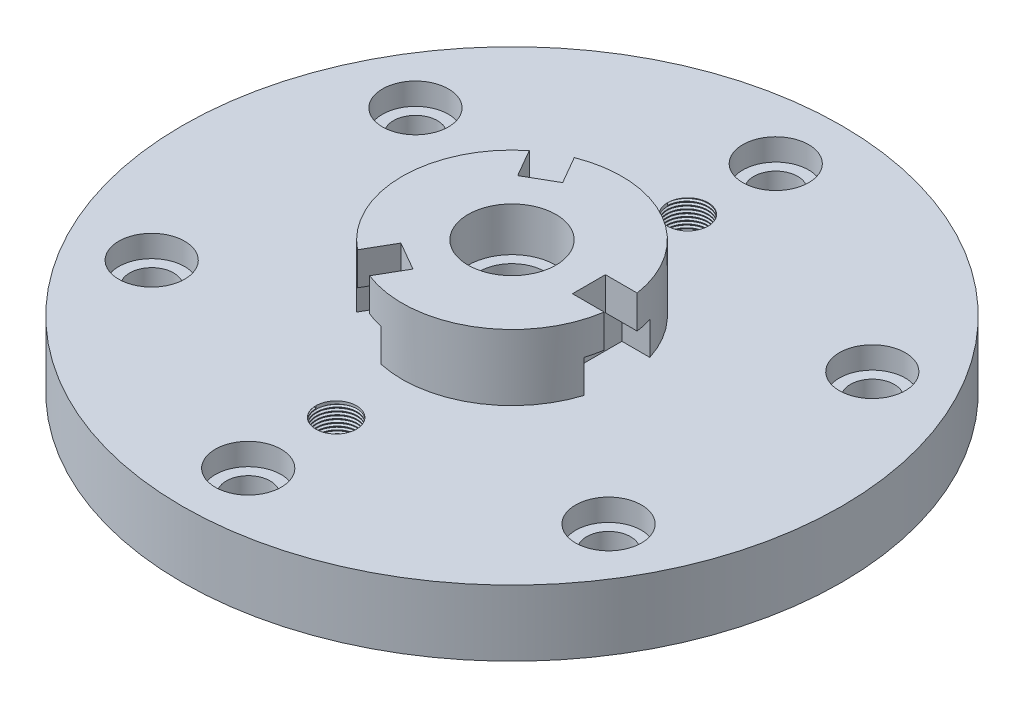
from build123d import *

# Parameters (mm, degrees)
CUT_EXTRUDE1_START                       = 35
CUT_EXTRUDE1_DEPTH                       = 200.520787991
CIRPATTERN1_COUNT                        = 3
CBORE_FOR_M20_HEX_HEAD_BOLT1_D           = 20
CBORE_FOR_M20_HEX_HEAD_BOLT1_CBORE_D     = 30
CBORE_FOR_M20_HEX_HEAD_BOLT1_CBORE_DEPTH = 10
CIRPATTERN2_COUNT                        = 6
TAP_DRILL_FOR_M20X1_5_TAP1_D             = 18.5
THREAD1_PITCH                            = 1.5
CUT_EXTRUDE4_START                       = 25
CUT_EXTRUDE4_DEPTH                       = 210.520788119


with BuildPart() as part:
    # Sketch1 → Revolve1 (revolve)
    with BuildSketch(Plane.XY, mode=Mode.PRIVATE) as revolve1_sk:
        with BuildLine():
            ThreePointArc((40, -50), (32.928932188, -52.928932188), (30, -60))
            Line((30, -60), (30, -100))
            Line((30, -100), (15, -100))
            Line((15, -100), (15, 10))
            Line((15, 10), (20, 10))
            Line((20, 10), (20, 30))
            Line((20, 30), (50, 30))
            Line((50, 30), (50, 0))
            Line((50, 0), (150, 0))
            Line((150, 0), (150, -30))
            Line((150, -30), (65, -30))
            ThreePointArc((65, -30), (61.464466094, -31.464466094), (60, -35))
            Line((60, -35), (60, -45))
            ThreePointArc((60, -45), (58.535533906, -48.535533906), (55, -50))
            Line((55, -50), (40, -50))
        make_face()
    revolve(revolve1_sk.sketch.rotate(Axis((0, -100, 0), (0, 1, 0)), 90), axis=Axis((0, -100, 0), (0, 1, 0)))

    # Sketch2 → Cut-Extrude1 (cut, through all)
    with BuildSketch(Plane(origin=(0, 0, 0), x_dir=(0, 0, -1), z_dir=(1, 0, 0)).offset(CUT_EXTRUDE1_START)):
        Polygon((-7.5, 30), (7.5, 30), (7.5, 15), (15, 15), (15, 0), (-15, 0), (-15, 15), (-7.5, 15), align=None)
    cut_extrude1 = extrude(amount=CUT_EXTRUDE1_DEPTH, mode=Mode.SUBTRACT)

    # CirPattern1: Cut-Extrude1 ×3 about axis
    cirpattern1_axis = Axis((0, 0, 0), (0, 1, 0))
    for i in range(1, CIRPATTERN1_COUNT):
        add(cut_extrude1.rotate(cirpattern1_axis, i * 360 / CIRPATTERN1_COUNT), mode=Mode.SUBTRACT)

    # CBORE for M20 Hex Head Bolt1 (through all)
    with Locations(Plane(origin=(0, 0, 0), x_dir=(1, 0, 0), z_dir=(0, 1, 0))):
        with Locations((0, 120)):
            cbore_for_m20_hex_head_bolt1 = CounterBoreHole(CBORE_FOR_M20_HEX_HEAD_BOLT1_D / 2, CBORE_FOR_M20_HEX_HEAD_BOLT1_CBORE_D / 2, CBORE_FOR_M20_HEX_HEAD_BOLT1_CBORE_DEPTH)

    # CirPattern2: CBORE for M20 Hex Head Bolt1 ×6 about axis
    cirpattern2_axis = Axis((0, 0, 0), (0, 1, 0))
    for i in range(1, CIRPATTERN2_COUNT):
        add(cbore_for_m20_hex_head_bolt1.rotate(cirpattern2_axis, i * 360 / CIRPATTERN2_COUNT), mode=Mode.SUBTRACT)

    # Tap Drill for M20x1.5 Tap1 (through all)
    with Locations(Plane(origin=(0, 0, 0), x_dir=(1, 0, 0), z_dir=(0, 1, 0))):
        with Locations((0, 80)):
            tap_drill_for_m20x1_5_tap1 = Hole(TAP_DRILL_FOR_M20X1_5_TAP1_D / 2)

    # Thread1: arcs per turn and ends read off the stored shape
    # Thread1: the profile of Thread Profile1 profile screwed along a right-hand helix through 20 turns, 8 arcs to a turn; built about Z, then put on its axis
    thread1_z = Axis((0, 0, 0), (0, 0, 1))
    thread1_corners = [(9.2497, 0, -0.000173205), (10.061898812, 0, 0.468749998), (10.061898812, 0, 0.656249998), (9.2497, 0, 1.125173201)]
    with BuildLine(mode=Mode.PRIVATE) as thread1_profile:
        Line(thread1_corners[0], thread1_corners[1])
        Line(thread1_corners[1], thread1_corners[2])
        Line(thread1_corners[2], thread1_corners[3])
        Line(thread1_corners[3], thread1_corners[0])
    thread1_cap = Face(thread1_profile.wire())
    thread1_turn_angles = [0, 22.5, 45, 67.5, 90, 112.5, 135, 157.5, 180, 202.5, 225, 247.5, 270, 292.5, 315, 337.5, 360]
    thread1_turn_weights = [1, 0.9238795325112867, 1, 0.9238795325112867, 1, 0.9238795325112867, 1, 0.9238795325112867, 1, 0.9238795325112867, 1, 0.9238795325112867, 1, 0.9238795325112867, 1, 0.9238795325112867, 1]
    thread1_turn_rails = [Edge.make_bspline([Vector(p[0], p[1], 0).rotate(thread1_z, thread1_turn_angles[k]) / thread1_turn_weights[k] + Vector(0, 0, p[2] + THREAD1_PITCH * thread1_turn_angles[k] / 360) for k in range(17)], [0, 0, 0, 1, 1, 2, 2, 3, 3, 4, 4, 5, 5, 6, 6, 7, 7, 8, 8, 8], 2, thread1_turn_weights) for p in thread1_corners]
    thread1_turn_sides = [Face.make_surface_from_curves(thread1_turn_rails[p[0]], thread1_turn_rails[p[1]]) for p in [(0, 1), (1, 2), (2, 3), (3, 0)]]
    thread1 = Plane(origin=(0, 0, -80), x_dir=(-1, 0, 0), z_dir=(0, -1, 0)) * Solid(Shell([*[p.moved(Location((0, 0, THREAD1_PITCH * i))) for i in range(20) for p in thread1_turn_sides], thread1_cap, thread1_cap.rotate(thread1_z, 7200).moved(Location((0, 0, THREAD1_PITCH * 7200 / 360)))]))
    add(thread1, mode=Mode.SUBTRACT)

    # Mirror1: Tap Drill for M20x1.5 Tap1, Thread1 across plane
    add(tap_drill_for_m20x1_5_tap1.mirror(Plane.XY), mode=Mode.SUBTRACT)
    add(thread1.mirror(Plane.XY), mode=Mode.SUBTRACT)

    # Sketch15 → Cut-Extrude4 (cut, through all)
    with BuildSketch(Plane(origin=(0, 0, 0), x_dir=(0, 0, -1), z_dir=(1, 0, 0)).offset(CUT_EXTRUDE4_START)):
        with BuildLine():
            Line((-8, -100), (-8, -70))
            ThreePointArc((-8, -70), (0, -62), (8, -70))
            Line((8, -70), (8, -100))
            Line((8, -100), (-8, -100))
        make_face()
    cut_extrude4 = extrude(amount=CUT_EXTRUDE4_DEPTH, mode=Mode.SUBTRACT)

    # Mirror2: Cut-Extrude4 across plane
    add(cut_extrude4.mirror(Plane(origin=(0, 0, 0), x_dir=(0, 0, 1), z_dir=(1, 0, 0))), mode=Mode.SUBTRACT)


solid = part.part
